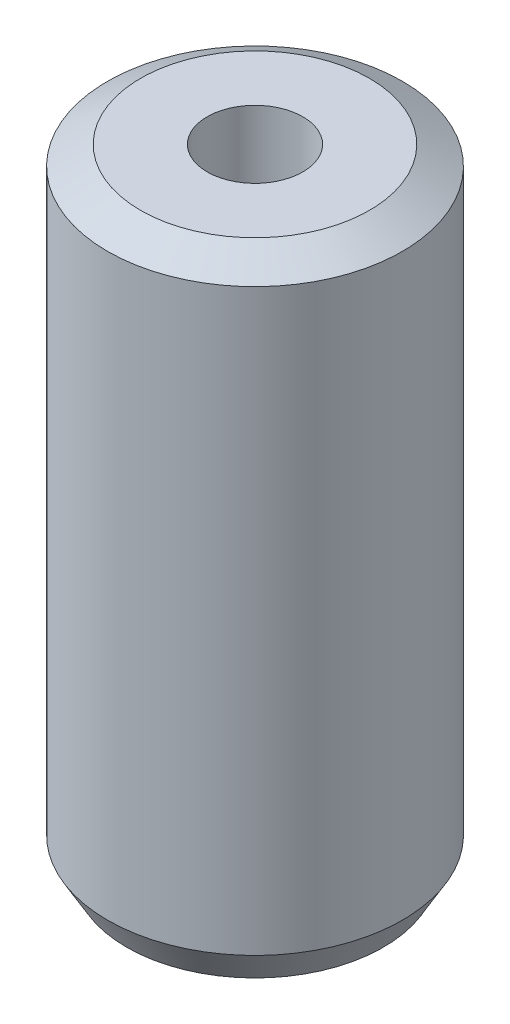
from build123d import *
from OCP.BRepFilletAPI import BRepFilletAPI_MakeChamfer

# Parameters (mm, degrees)
SKETCH1_R           = 42.5
BOSS_EXTRUDE1_DEPTH = 182.001182838
SKETCH2_R           = 13.790577644
CUT_EXTRUDE1_DEPTH  = 192.668804333
CHAMFER1_SIZE       = 5.490198879
CHAMFER1_SIZE2      = 9.509303402


with BuildPart() as part:
    # Sketch1 → Boss-Extrude1 (new body)
    with BuildSketch(Plane(origin=(0, 0, 0), x_dir=(1, 0, 0), z_dir=(0, 1, 0))):
        Circle(SKETCH1_R)
    extrude(amount=BOSS_EXTRUDE1_DEPTH)

    # Sketch2 → Cut-Extrude1 (cut, through all)
    with BuildSketch(Plane(origin=(0, 0, 0), x_dir=(1, 0, 0), z_dir=(0, 1, 0))):
        Circle(SKETCH2_R)
    extrude(amount=CUT_EXTRUDE1_DEPTH, mode=Mode.SUBTRACT)

    # Chamfer1: one chamfer whose edges measure the first distance from different faces: ONE call of the kernel's chamfer builder (chamfer() names one face for all edges)
    chamfer1_edges_1 = [part.edges().sort_by_distance(p)[0] for p in [
        (-42.5, 182.001182838, 0),
    ]]
    chamfer1_side_1 = [part.faces().sort_by_distance(p)[0] for p in [
        (-42.5, 91.000591419, 0),
    ]]
    chamfer1_edges_2 = [part.edges().sort_by_distance(p)[0] for p in [
        (-42.5, 0, 0),
    ]]
    chamfer1_side_2 = [part.faces().sort_by_distance(p)[0] for p in [
        (-41.297918472, 0, 0),
    ]]
    chamfer1 = BRepFilletAPI_MakeChamfer(part.part.solid().wrapped)
    for e in chamfer1_edges_1:
        chamfer1.Add(CHAMFER1_SIZE, CHAMFER1_SIZE2, e.wrapped, chamfer1_side_1[0].wrapped)  # the first distance lies on this face
    for e in chamfer1_edges_2:
        chamfer1.Add(CHAMFER1_SIZE, CHAMFER1_SIZE2, e.wrapped, chamfer1_side_2[0].wrapped)  # the first distance lies on this face
    add(Compound.cast(chamfer1.Shape()), mode=Mode.REPLACE)


solid = part.part
